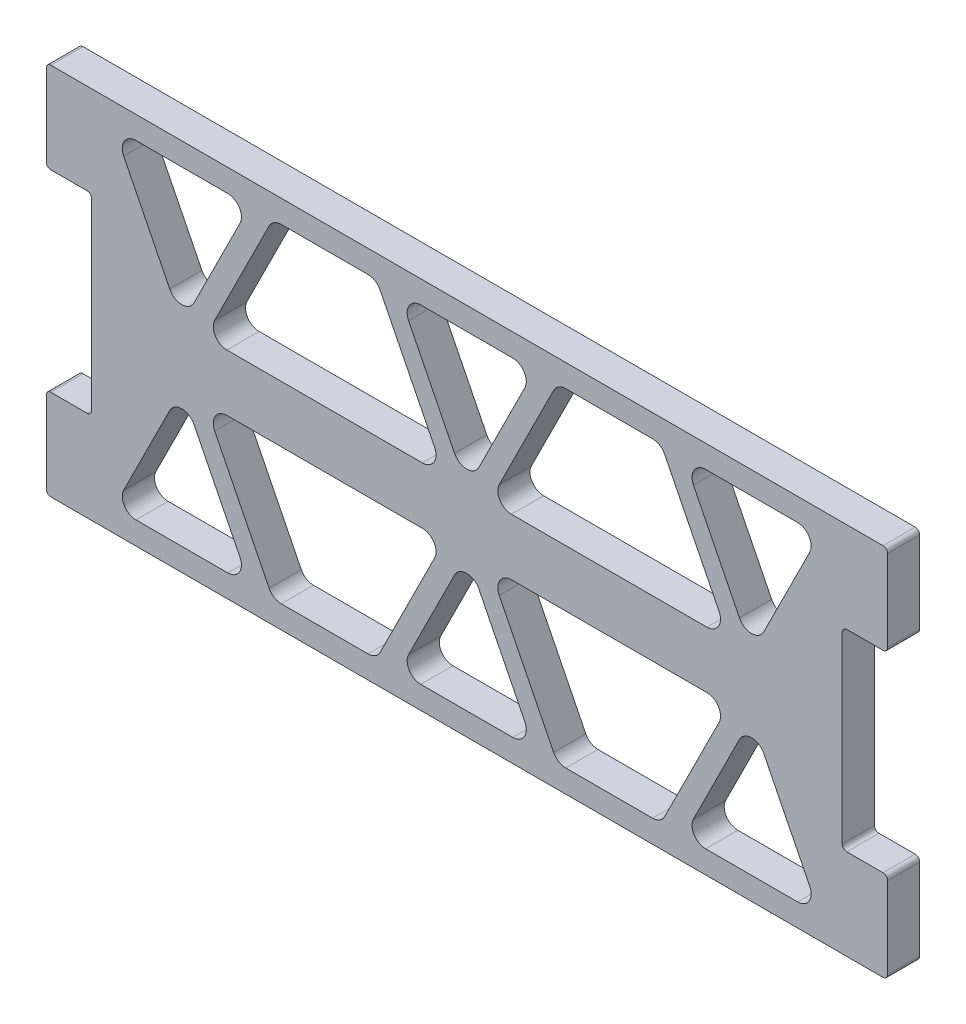
from build123d import *

# Parameters (mm, degrees)
SKETCH1_W            = 105.1814
SKETCH1_H            = 68.320954018
BOSS_EXTRUDE1_DEPTH  = 4.5085
SKETCH2_W            = 105.1814
SKETCH2_H            = 15.933454036
CUT_EXTRUDE1_DEPTH   = 10.795
SKETCH3_W            = 6.35
SKETCH3_H            = 12.7
BOSS_EXTRUDE2_DEPTH  = 4.5085
FILLET1_R            = 0.635
CUT_EXTRUDE2_DEPTH   = 4.7625
LPATTERN1_COUNT      = 3
LPATTERN1_PITCH      = 39.916133528
CUT_EXTRUDE3_DEPTH   = 4.7625
FILLET2_R            = 1.905
MIRROR3_COPY_1_DEPTH = 4.7625
MIRROR3_COPY_2_DEPTH = 4.7625
MIRROR3_COPY_3_DEPTH = 4.7625
MIRROR3_COPY_4_DEPTH = 4.7625
MIRROR3_COPY_5_DEPTH = 4.7625
FILLET3_R            = 1.905


with BuildPart() as part:
    # Sketch1 → Boss-Extrude1 (new body)
    with BuildSketch(Plane.XY):
        Rectangle(SKETCH1_W, SKETCH1_H)
    extrude(amount=BOSS_EXTRUDE1_DEPTH)

    # Sketch2 → Cut-Extrude1 (cut)
    with BuildSketch(Plane.XY.offset(4.5085)):
        with Locations((0, 26.193749991)):
            Rectangle(SKETCH2_W, SKETCH2_H)
    extrude(amount=-CUT_EXTRUDE1_DEPTH, mode=Mode.SUBTRACT)

    # Sketch3 → Boss-Extrude2 (add)
    with BuildSketch(Plane.XY.offset(4.5085)):
        with Locations((-55.7657, -27.810477009)):
            Rectangle(SKETCH3_W, SKETCH3_H)
        with Locations((-55.7657, 11.877022991)):
            Rectangle(SKETCH3_W, SKETCH3_H)
    boss_extrude2 = extrude(amount=-BOSS_EXTRUDE2_DEPTH)

    # Mirror1: Boss-Extrude2 across plane
    add(boss_extrude2.mirror(Plane(origin=(0, 0, 0), x_dir=(0, 0, 1), z_dir=(1, 0, 0))))

    # Fillet1
    fillet1_edges = [part.edges().sort_by_distance(p)[0] for p in [
        (58.9407, 18.227022991, 2.25425),
        (58.9407, 5.527022991, 2.25425),
        (52.5907, 5.527022991, 2.25425),
        (52.5907, -21.460477009, 2.25425),
        (58.9407, -21.460477009, 2.25425),
        (58.9407, -34.160477009, 2.25425),
        (-52.5907, 5.527022991, 2.25425),
        (-52.5907, -21.460477009, 2.25425),
        (-58.9407, -34.160477009, 2.25425),
        (-58.9407, 5.527022991, 2.25425),
        (-58.9407, 18.227022991, 2.25425),
        (-58.9407, -21.460477009, 2.25425),
    ]]
    fillet(fillet1_edges, radius=FILLET1_R)

    # Sketch4 → Cut-Extrude2 (cut)
    with BuildSketch(Plane(origin=(0, 0, 0), x_dir=(-1, 0, 0), z_dir=(0, 0, -1))):
        Polygon((-49.4157, 15.052022973), (-30.3657, 15.052022973), (-39.8907, -3.997977027), align=None)
    cut_extrude2 = extrude(amount=-CUT_EXTRUDE2_DEPTH, mode=Mode.SUBTRACT)

    # LPattern1: Cut-Extrude2 ×3
    with Locations(*[(-i * LPATTERN1_PITCH, 0, 0) for i in range(1, LPATTERN1_COUNT)]):
        add(cut_extrude2, mode=Mode.SUBTRACT)

    # Sketch5 → Cut-Extrude3 (cut)
    with BuildSketch(Plane(origin=(0, 0, 0), x_dir=(-1, 0, 0), z_dir=(0, 0, -1))):
        Polygon((-27.1907, 15.052022973), (-12.674566472, 15.052022973), (-3.149566472, -3.997977027), (-36.7157, -3.997977027), align=None)
    cut_extrude3 = extrude(amount=-CUT_EXTRUDE3_DEPTH, mode=Mode.SUBTRACT)

    # Mirror2: Cut-Extrude3 across plane
    add(cut_extrude3.mirror(Plane(origin=(0, 0, 0), x_dir=(0, 0, 1), z_dir=(1, 0, 0))), mode=Mode.SUBTRACT)

    # Fillet2
    fillet2_edges = [part.edges().sort_by_distance(p)[0] for p in [
        (-49.466567056, 15.052022973, 2.25425),
        (-39.941567056, -3.997977027, 2.25425),
        (-30.416567056, 15.052022973, 2.25425),
        (-9.550433528, 15.052022973, 2.25425),
        (9.499566472, 15.052022973, 2.25425),
        (30.3657, 15.052022973, 2.25425),
        (-0.025433528, -3.997977027, 2.25425),
        (39.8907, -3.997977027, 2.25425),
        (49.4157, 15.052022973, 2.25425),
    ]]
    fillet(fillet2_edges, radius=FILLET2_R)

    # Mirror3 copy 1 sketch → Mirror3 copy 1 (cut)
    with BuildSketch(Plane(origin=(-39.916133528, -15.933454036, 0), x_dir=(-1, 0, 0), z_dir=(0, 0, -1))):
        Polygon((-49.4157, -15.052022973), (-30.3657, -15.052022973), (-39.8907, 3.997977027), align=None)
    extrude(amount=-MIRROR3_COPY_1_DEPTH, mode=Mode.SUBTRACT)

    # Mirror3 copy 2 sketch → Mirror3 copy 2 (cut)
    with BuildSketch(Plane(origin=(-79.832267056, -15.933454036, 0), x_dir=(-1, 0, 0), z_dir=(0, 0, -1))):
        Polygon((-49.4157, -15.052022973), (-30.3657, -15.052022973), (-39.8907, 3.997977027), align=None)
    extrude(amount=-MIRROR3_COPY_2_DEPTH, mode=Mode.SUBTRACT)

    # Mirror3 copy 3 sketch → Mirror3 copy 3 (cut)
    with BuildSketch(Plane(origin=(0, -15.933454036, 0), x_dir=(-1, 0, 0), z_dir=(0, 0, -1))):
        Polygon((-49.4157, -15.052022973), (-30.3657, -15.052022973), (-39.8907, 3.997977027), align=None)
    extrude(amount=-MIRROR3_COPY_3_DEPTH, mode=Mode.SUBTRACT)

    # Mirror3 copy 4 sketch → Mirror3 copy 4 (cut)
    with BuildSketch(Plane(origin=(0, -15.933454036, 0), x_dir=(1, 0, 0), z_dir=(0, 0, -1))):
        Polygon((-27.1907, 15.052022973), (-12.674566472, 15.052022973), (-3.149566472, -3.997977027), (-36.7157, -3.997977027), align=None)
    extrude(amount=-MIRROR3_COPY_4_DEPTH, mode=Mode.SUBTRACT)

    # Mirror3 copy 5 sketch → Mirror3 copy 5 (cut)
    with BuildSketch(Plane(origin=(0, -15.933454036, 0), x_dir=(-1, 0, 0), z_dir=(0, 0, -1))):
        Polygon((-27.1907, -15.052022973), (-12.674566472, -15.052022973), (-3.149566472, 3.997977027), (-36.7157, 3.997977027), align=None)
    extrude(amount=-MIRROR3_COPY_5_DEPTH, mode=Mode.SUBTRACT)

    # Fillet3
    fillet3_edges = [part.edges().sort_by_distance(p)[0] for p in [
        (3.149566472, -11.935477009, 2.25425),
        (36.7157, -11.935477009, 2.25425),
        (39.8907, -11.935477009, 2.25425),
        (30.3657, -30.985477009, 2.25425),
        (12.674566472, -30.985477009, 2.25425),
        (49.4157, -30.985477009, 2.25425),
        (27.1907, -30.985477009, 2.25425),
        (9.499566472, -30.985477009, 2.25425),
        (-0.025433528, -11.935477009, 2.25425),
        (-9.550433528, -30.985477009, 2.25425),
        (-49.466567056, -30.985477009, 2.25425),
        (-30.416567056, -30.985477009, 2.25425),
        (-39.941567056, -11.935477009, 2.25425),
        (-3.149566472, -11.935477009, 2.25425),
        (-12.674566472, -30.985477009, 2.25425),
        (-27.1907, -30.985477009, 2.25425),
        (-36.7157, -11.935477009, 2.25425),
        (-36.7157, -3.997977027, 2.25425),
        (-3.149566472, -3.997977027, 2.25425),
        (-27.1907, 15.052022973, 2.25425),
        (-12.674566472, 15.052022973, 2.25425),
        (27.1907, 15.052022973, 2.25425),
        (12.674566472, 15.052022973, 2.25425),
        (3.149566472, -3.997977027, 2.25425),
        (36.7157, -3.997977027, 2.25425),
    ]]
    fillet(fillet3_edges, radius=FILLET3_R)


solid = part.part
